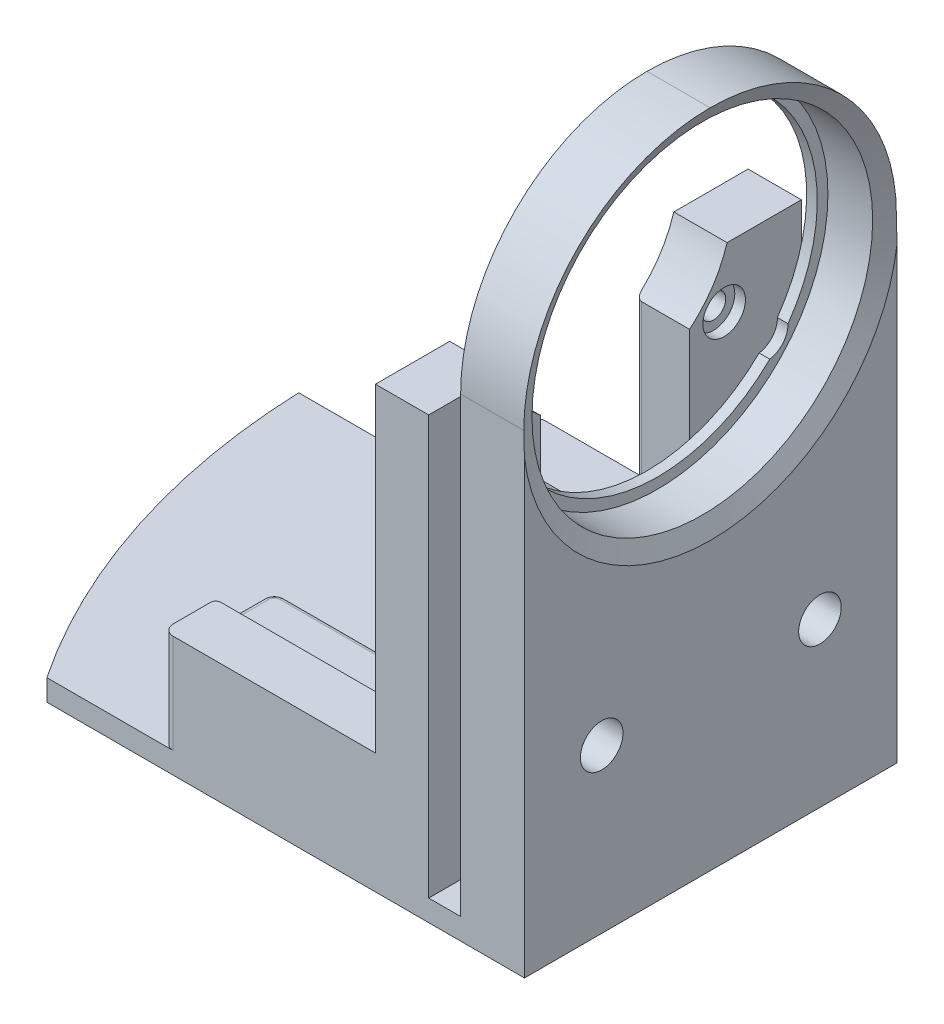
from build123d import *

# Parameters (mm, degrees)
EXTRUDE_1_DEPTH     = 2
SKETCH_2_W          = 6
SKETCH_2_H          = 35
EXTRUDE_2_DEPTH     = 60
FILLET_1_R          = 17.5
SKETCH_3_R          = 16
CUT_EXTRUDE_1_DEPTH = 5
CHAMFER_1_SIZE      = 1.640243073
CHAMFER_1_SIZE_2    = 0.8
SKETCH_4_R          = 15
CUT_EXTRUDE_2_DEPTH = 105.385422037
SKETCH_5_W          = 25
SKETCH_5_H          = 10.5
EXTRUDE_3_DEPTH     = 7.3
EXTRUDE_4_DEPTH     = 2
FILLET_2_R          = 1
EXTRUDE_5_DEPTH     = 5
SKETCH_9_R          = 1.15
CUT_EXTRUDE_3_DEPTH = 101.277297201
SKETCH_10_R         = 2
CUT_EXTRUDE_4_DEPTH = 10
FILLET_3_R          = 0.5
SKETCH_12_W         = 56.21
SKETCH_12_H         = 29.03
CUT_EXTRUDE_5_DEPTH = 113.159332301


# Some blends are built 0.0001 mm under size
with BuildPart() as part:
    # 스케치1 → 보스-돌출1 (new body)
    with BuildSketch(Plane(origin=(0, 0, 0), x_dir=(1, 0, 0), z_dir=(0, 1, 0))):
        with BuildLine():
            Line((-11.24267666, -2.527135016), (-67.45267666, -2.527135016))
            ThreePointArc((-67.45267666, -2.527135016), (-50.72671765, -44.531450868), (-11.24267666, -66.557135016))
            Line((-11.24267666, -66.557135016), (-11.24267666, -2.527135016))
        make_face()
    extrude(amount=EXTRUDE_1_DEPTH)

    # 스케치2 → 보스-돌출2 (add)
    with BuildSketch(Plane(origin=(0, 2, 0), x_dir=(1, 0, 0), z_dir=(0, 1, 0))):
        with Locations((-14.24267666, -20.027135016)):
            Rectangle(SKETCH_2_W, SKETCH_2_H)
    extrude(amount=EXTRUDE_2_DEPTH)

    # 필렛1
    fillet_1_edges = [part.edges().sort_by_distance(p)[0] for p in [
        (-14.24267666, 62, 2.527135016),
        (-14.24267666, 62, 37.527135016),
    ]]
    fillet(fillet_1_edges, radius=FILLET_1_R - 0.0001)  # a hair under: the kernel refuses the full size

    # 스케치3 → 컷-돌출1 (cut)
    with BuildSketch(Plane(origin=(-11.24267666, 0, 0), x_dir=(0, 0, -1), z_dir=(1, 0, 0))):
        with Locations((-20.027135016, 44.5)):
            Circle(SKETCH_3_R)
    extrude(amount=-CUT_EXTRUDE_1_DEPTH, mode=Mode.SUBTRACT)

    # 모따기1
    # the kernel refuses this chamfer: 1.640243073, 0.8 mm, written as the material it takes off along each edge
    with BuildSketch(Plane(origin=(-11.24267666, 44.5, 20.027135016), x_dir=(0, 0, -1), z_dir=(0, -1, 0))) as chamfer_1_piece_1:
        Polygon((16 + CHAMFER_1_SIZE, 0), (16, -CHAMFER_1_SIZE_2), (16, 0), align=None)
    revolve(axis=Axis((-11.24267666, 44.5, 20.027135016), (1, 0, 0)), mode=Mode.SUBTRACT)

    # 스케치4 → 컷-돌출2 (cut, through all)
    with BuildSketch(Plane(origin=(-16.24267666, 0, 0), x_dir=(0, 0, -1), z_dir=(1, 0, 0))):
        with Locations((-20.027135016, 44.5)):
            Circle(SKETCH_4_R)
    extrude(amount=-CUT_EXTRUDE_2_DEPTH, mode=Mode.SUBTRACT)

    # 스케치5 → 보스-돌출3 (add)
    with BuildSketch(Plane(origin=(0, 2, 0), x_dir=(1, 0, 0), z_dir=(0, 1, 0))):
        with Locations((-32.74267666, -7.777135016)):
            Rectangle(SKETCH_5_W, SKETCH_5_H)
        with Locations((-32.74267666, -32.277135016)):
            Rectangle(SKETCH_5_W, SKETCH_5_H)
    extrude(amount=EXTRUDE_3_DEPTH)

    # 스케치6 → 보스-돌출4 (add)
    with BuildSketch(Plane(origin=(0, 9.3, 0), x_dir=(1, 0, 0), z_dir=(0, 1, 0))):
        Polygon((-45.24267666, -32.527135016), (-25.24267666, -32.527135016), (-25.24267666, -27.027135016), (-20.24267666, -27.027135016), (-20.24267666, -37.527135016), (-45.24267666, -37.527135016), align=None)
        Polygon((-45.24267666, -2.527135016), (-20.24267666, -2.527135016), (-20.24267666, -13.027135016), (-25.24267666, -13.027135016), (-25.24267666, -7.527135016), (-45.24267666, -7.527135016), align=None)
    extrude(amount=EXTRUDE_4_DEPTH)

    # 필렛2
    fillet_2_edges = [part.edges().sort_by_distance(p)[0] for p in [
        (-45.24267666, 6.65, 2.527135016),
        (-45.24267666, 5.65, 13.027135016),
        (-45.24267666, 5.65, 27.027135016),
        (-45.24267666, 6.65, 37.527135016),
    ]]
    fillet(fillet_2_edges, radius=FILLET_2_R)

    # 스케치7 → 보스-돌출5 (add)
    with BuildSketch(Plane.ZY.offset(25.24267666)):
        with BuildLine():
            Line((2.527135016, 11.3), (13.027135016, 11.3))
            Line((13.027135016, 11.3), (13.027135016, 36.014718626))
            ThreePointArc((13.027135016, 36.014718626), (10.875170651, 38.397414624), (9.502877322, 41.3))
            Line((9.502877322, 41.3), (2.527135016, 41.3))
            Line((2.527135016, 41.3), (2.527135016, 11.3))
        make_face()
        with BuildLine():
            Line((37.527135016, 11.3), (27.027135016, 11.3))
            Line((27.027135016, 11.3), (27.027135016, 36.014718626))
            ThreePointArc((27.027135016, 36.014718626), (29.17909938, 38.397414624), (30.551392709, 41.3))
            Line((30.551392709, 41.3), (37.527135016, 41.3))
            Line((37.527135016, 41.3), (37.527135016, 11.3))
        make_face()
    extrude(amount=-EXTRUDE_5_DEPTH)

    # 스케치9 → 컷-돌출3 (cut, through all)
    with BuildSketch(Plane.ZY.offset(25.24267666)):
        with Locations((9.777135016, 35.8)):
            Circle(SKETCH_9_R)
        with Locations((9.777135016, 15.3)):
            Circle(SKETCH_9_R)
        with Locations((30.277135016, 15.3)):
            Circle(SKETCH_9_R)
        with Locations((30.277135016, 35.8)):
            Circle(SKETCH_9_R)
    extrude(amount=-CUT_EXTRUDE_3_DEPTH, mode=Mode.SUBTRACT)

    # 스케치10 → 컷-돌출4 (cut)
    with BuildSketch(Plane(origin=(-11.24267666, 0, 0), x_dir=(0, 0, -1), z_dir=(1, 0, 0))):
        with Locations((-30.277135016, 15.3)):
            Circle(SKETCH_10_R)
        with Locations((-9.777135016, 15.3)):
            Circle(SKETCH_10_R)
        with Locations((-9.777135016, 35.8)):
            Circle(SKETCH_10_R)
        with Locations((-30.277135016, 35.8)):
            Circle(SKETCH_10_R)
    extrude(amount=-CUT_EXTRUDE_4_DEPTH, mode=Mode.SUBTRACT)

    # 필렛3
    fillet_3_edges = [part.edges().sort_by_distance(p)[0] for p in [
        (-45.24267666, 10.3, 32.527135016),
        (-25.24267666, 22.657359313, 27.027135016),
        (-35.24267666, 9.3, 32.527135016),
        (-45.24267666, 9.3, 30.277135016),
        (-44.949783441, 9.3, 27.320028235),
        (-34.74267666, 9.3, 13.027135016),
        (-44.949783441, 9.3, 12.734241797),
        (-45.24267666, 9.3, 9.777135016),
        (-35.24267666, 9.3, 7.527135016),
        (-45.24267666, 10.3, 7.527135016),
        (-25.24267666, 22.657359313, 13.027135016),
        (-34.74267666, 9.3, 27.027135016),
    ]]
    fillet(fillet_3_edges, radius=FILLET_3_R)

    # 스케치12 → 컷-돌출5 (cut, through all)
    with BuildSketch(Plane(origin=(0, 2, 0), x_dir=(1, 0, 0), z_dir=(0, 1, 0))):
        with Locations((-39.34767666, -52.042135016)):
            Rectangle(SKETCH_12_W, SKETCH_12_H)
    extrude(amount=-CUT_EXTRUDE_5_DEPTH, mode=Mode.SUBTRACT)


solid = part.part
